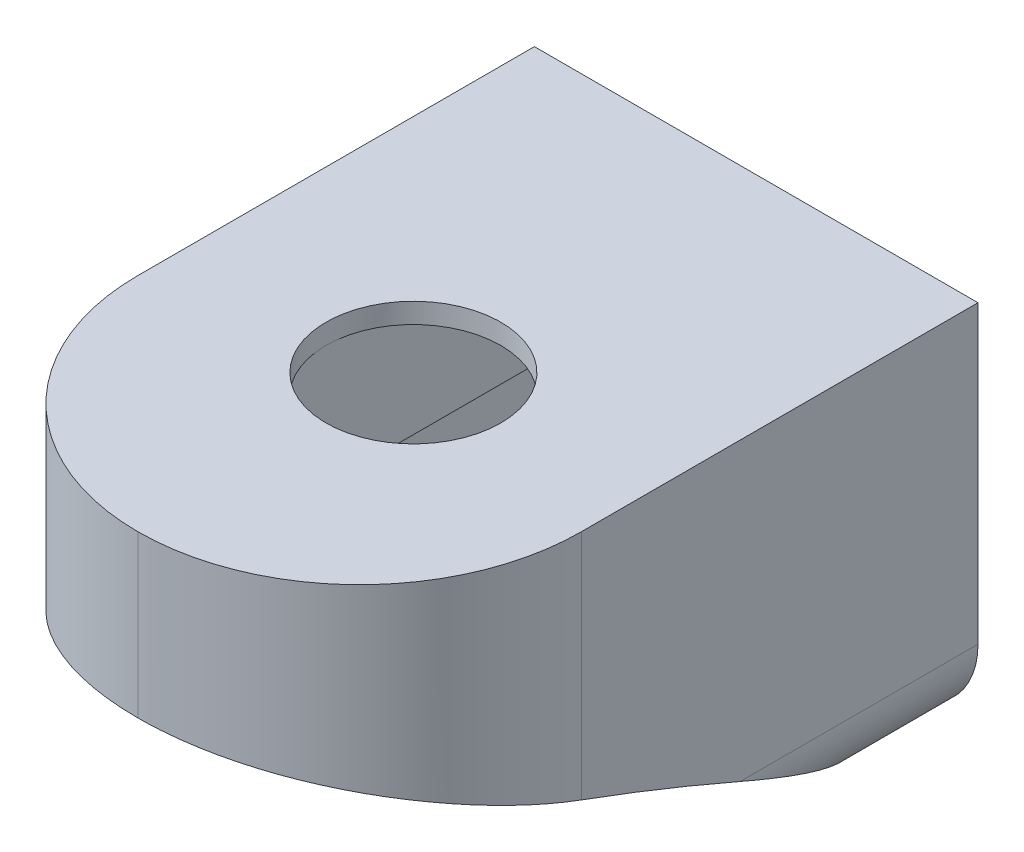
from build123d import *

# Parameters (mm, degrees)
SKETCH1_W           = 33
SKETCH1_H           = 28
BOSS_EXTRUDE1_DEPTH = 46
CUT_EXTRUDE2_DEPTH  = 59.318093247
CUT_EXTRUDE3_START  = -3
CUT_EXTRUDE3_DEPTH  = 27
FILLET1_R           = 12.5
FILLET2_R           = 16.5
FILLET3_R           = 6
SKETCH4_W           = 13
SKETCH4_H           = 23
CUT_EXTRUDE4_DEPTH  = 9
SKETCH5_R           = 6.5
CUT_EXTRUDE5_DEPTH  = 56.592265809
SKETCH6_R           = 1
CUT_EXTRUDE6_DEPTH  = 8
SKETCH7_R           = 1
SKETCH7_R_2         = 2.5
CUT_EXTRUDE7_DEPTH  = 2.5


with BuildPart() as part:
    # Sketch1 → Boss-Extrude1 (new body)
    with BuildSketch(Plane.XY):
        Rectangle(SKETCH1_W, SKETCH1_H)
    extrude(amount=BOSS_EXTRUDE1_DEPTH)

    # Sketch2 → Cut-Extrude2 (cut, through all)
    with BuildSketch(Plane(origin=(16.5, 0, 0), x_dir=(0, 0, -1), z_dir=(1, 0, 0))):
        with BuildLine():
            Line((-46, 2), (-46, -14))
            Line((-46, -14), (-5, -14))
            add(Edge.make_bspline(
                [(-5, -14), (-24.787424695, -3.854626285), (-46, 2)],
                knots=[0, 0, 0, 1, 1, 1], degree=2))
        make_face()
    extrude(amount=-CUT_EXTRUDE2_DEPTH, mode=Mode.SUBTRACT)

    # Sketch3 → Cut-Extrude3 (cut)
    with BuildSketch(Plane(origin=(16.5, 0, 0), x_dir=(0, 0, -1), z_dir=(1, 0, 0)).offset(CUT_EXTRUDE3_START)):
        with BuildLine():
            Line((-5, -14), (-2.5, -14))
            Line((-2.5, -14), (-2.5, 3.5))
            Line((-2.5, 3.5), (-40.5, 3.5))
            Line((-40.5, 3.5), (-40.5, 0.402594989))
            add(Edge.make_bspline(
                [(-5, -14), (-22.210911626, -5.175651551), (-40.5, 0.402594989)],
                knots=[0, 0, 0, 1, 1, 1], degree=2))
        make_face()
    extrude(amount=-CUT_EXTRUDE3_DEPTH, mode=Mode.SUBTRACT)

    # Fillet1
    fillet1_edges = [part.edges().sort_by_distance(p)[0] for p in [
        (13.5, 1.951297494, 40.5),
        (-13.5, 1.951297494, 40.5),
    ]]
    fillet(fillet1_edges, radius=FILLET1_R)

    # Fillet2
    fillet2_edges = [part.edges().sort_by_distance(p)[0] for p in [
        (16.5, 8, 46),
        (-16.5, 8, 46),
    ]]
    fillet(fillet2_edges, radius=FILLET2_R - 0.0001)  # a hair under: the kernel refuses the full size

    # Fillet3
    fillet3_edges = [part.edges().sort_by_distance(p)[0] for p in [
        (16.5, -14, 2.5),
        (-16.5, -14, 2.5),
    ]]
    fillet(fillet3_edges, radius=FILLET3_R)

    # Sketch4 → Cut-Extrude4 (cut)
    with BuildSketch(Plane.XZ.offset(-3.5)):
        with Locations((0, 20.5)):
            Rectangle(SKETCH4_W, SKETCH4_H)
    extrude(amount=-CUT_EXTRUDE4_DEPTH, mode=Mode.SUBTRACT)

    # Sketch5 → Cut-Extrude5 (cut, through all)
    with BuildSketch(Plane.XZ.offset(-12.5)):
        with Locations((0, 25.5)):
            Circle(SKETCH5_R)
    extrude(amount=-CUT_EXTRUDE5_DEPTH, mode=Mode.SUBTRACT)

    # Sketch6 → Cut-Extrude6 (cut)
    with BuildSketch(Plane.XZ.offset(-3.5)):
        with Locations((0, 34.3)):
            Circle(SKETCH6_R)
        with Locations((0, 6.7)):
            Circle(SKETCH6_R)
    extrude(amount=-CUT_EXTRUDE6_DEPTH, mode=Mode.SUBTRACT)

    # Sketch7 → Cut-Extrude7 (cut)
    with BuildSketch(Plane(origin=(0, 0, 0), x_dir=(-1, 0, 0), z_dir=(0, 0, -1))):
        with Locations((-9.5, 0)):
            Circle(SKETCH7_R)
        with Locations((-5, 0)):
            Circle(SKETCH7_R_2)
        with Locations((-0.5, 0)):
            Circle(SKETCH7_R)
    extrude(amount=-CUT_EXTRUDE7_DEPTH, mode=Mode.SUBTRACT)


solid = part.part
